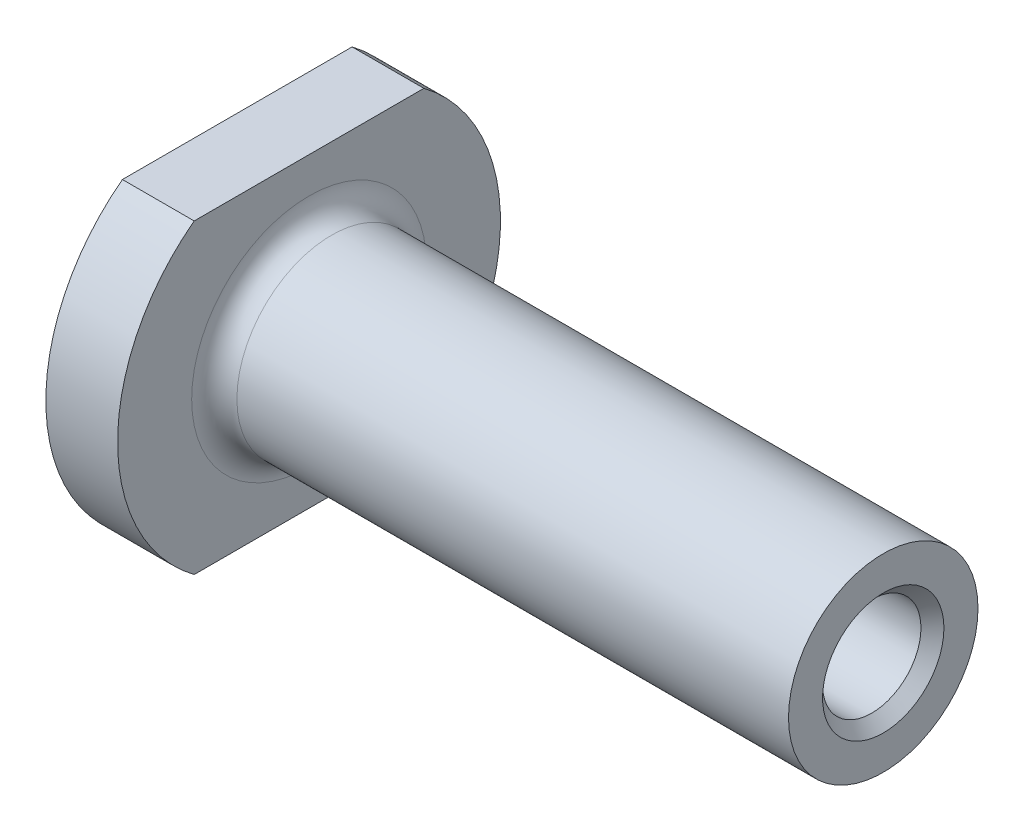
from build123d import *

# Parameters (mm, degrees)
FILLET1_R             = 1.5
HOLE_WIZARD_5_16_18_D = 6.5278
CUT_EXTRUDE1_DEPTH    = 47.473367709
CHAMFER1_SIZE         = 0.762


with BuildPart() as part:
    # Sketch1 → Revolve1 (revolve)
    with BuildSketch(Plane.XY):
        Polygon((0, 0), (42.8625, 0), (42.8625, 6.2865), (4.7625, 6.2865), (4.7625, 12.7), (0, 12.7), align=None)
    revolve(axis=Axis((0, 0, 0), (-1, 0, 0)))

    # Fillet1
    fillet1_edges = [part.edges().sort_by_distance(p)[0] for p in [
        (4.7625, -6.2865, 0),
    ]]
    fillet(fillet1_edges, radius=FILLET1_R)

    # 5/16-18 (through all)
    with Locations(Plane(origin=(42.8625, 0, 0), x_dir=(0, 0, -1), z_dir=(1, 0, 0))):
        with Locations((0, 0)):
            Hole(HOLE_WIZARD_5_16_18_D / 2)

    # Sketch4 → Cut-Extrude1 (cut, through all)
    with BuildSketch(Plane.ZY):
        with BuildLine():
            Line((-7.62, 10.16), (7.62, 10.16))
            ThreePointArc((7.62, 10.16), (0, 12.7), (-7.62, 10.16))
        make_face()
        with BuildLine():
            Line((7.62, -10.16), (-7.62, -10.16))
            ThreePointArc((-7.62, -10.16), (0, -12.7), (7.62, -10.16))
        make_face()
    extrude(amount=-CUT_EXTRUDE1_DEPTH, mode=Mode.SUBTRACT)

    # Chamfer1
    chamfer1_edges = [part.edges().sort_by_distance(p)[0] for p in [
        (0, 0, -3.2639),
        (42.8625, 0, -3.2639),
    ]]
    chamfer(chamfer1_edges, length=CHAMFER1_SIZE)


solid = part.part
